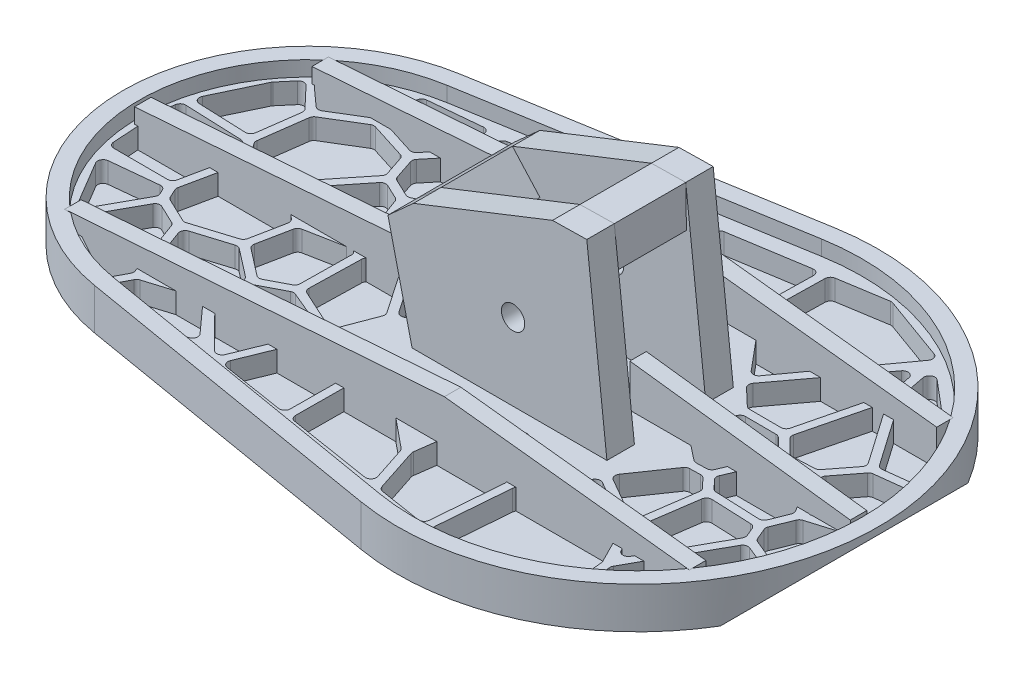
from build123d import *

# Parameters (mm, degrees)
BOSS_EXTRUDE1_DEPTH  = 0.8
BOSS_EXTRUDE2_DEPTH  = 6
BOSS_EXTRUDE3_DEPTH  = 3
BOSS_EXTRUDE4_DEPTH  = 2.4
BOSS_EXTRUDE5_DEPTH  = 2.4
BOSS_EXTRUDE6_DEPTH  = 2.4
BOSS_EXTRUDE7_DEPTH  = 2.4
CUT_EXTRUDE1_DEPTH   = 80
SKETCH9_R            = 1.7
BOSS_EXTRUDE8_DEPTH  = 4
SKETCH10_R           = 1.7
BOSS_EXTRUDE9_DEPTH  = 4
BOSS_EXTRUDE10_DEPTH = 10.4


with BuildPart() as part:
    # Sketch1 → Boss-Extrude1 (new body)
    with BuildSketch(Plane(origin=(0, 34.84807753, 0), x_dir=(1, 0, 0), z_dir=(0, 1, 0))):
        with BuildLine():
            Line((258.230600508, -326.377640976), (304.897267175, -318.489534599))
            ThreePointArc((304.897267175, -318.489534599), (345.730600508, -353), (304.897267175, -387.510465401))
            Line((304.897267175, -387.510465401), (258.230600508, -379.622359024))
            ThreePointArc((258.230600508, -379.622359024), (235.730600508, -353), (258.230600508, -326.377640976))
        make_face()
    extrude(amount=BOSS_EXTRUDE1_DEPTH)

    # Sketch2 → Boss-Extrude2 (add)
    with BuildSketch(Plane(origin=(0, 34.84807753, 0), x_dir=(1, 0, 0), z_dir=(0, 1, 0))):
        with BuildLine():
            Line((258.230600508, -326.377640976), (304.897267175, -318.489534599))
            ThreePointArc((304.897267175, -318.489534599), (345.730600508, -353), (304.897267175, -387.510465401))
            Line((304.897267175, -387.510465401), (258.230600508, -379.622359024))
            ThreePointArc((258.230600508, -379.622359024), (235.730600508, -353), (258.230600508, -326.377640976))
        make_face()
        with BuildLine():
            Line((258.630600508, -328.744072889), (305.297267175, -320.855966512))
            ThreePointArc((305.297267175, -320.855966512), (343.330600508, -353), (305.297267175, -385.144033488))
            Line((305.297267175, -385.144033488), (258.630600508, -377.255927111))
            ThreePointArc((258.630600508, -377.255927111), (238.130600508, -353), (258.630600508, -328.744072889))
        make_face(mode=Mode.SUBTRACT)
    extrude(amount=BOSS_EXTRUDE2_DEPTH)

    # Sketch3 → Boss-Extrude3 (add)
    with BuildSketch(Plane(origin=(0, 35.64807753, 0), x_dir=(1, 0, 0), z_dir=(0, 1, 0))):
        with BuildLine():
            Line((258.630600508, -328.744072889), (305.297267175, -320.855966512))
            ThreePointArc((305.297267175, -320.855966512), (343.330600508, -353), (305.297267175, -385.144033488))
            Line((305.297267175, -385.144033488), (258.630600508, -377.255927111))
            ThreePointArc((258.630600508, -377.255927111), (238.130600508, -353), (258.630600508, -328.744072889))
        make_face()
        with BuildLine():
            Line((326.922143782, -349.480574758), (324.399924628, -355.488488963))
            ThreePointArc((324.399924628, -355.488488963), (324.112742556, -355.839948352), (323.680573177, -355.978609348))
            Line((323.680573177, -355.978609348), (322.223942781, -356.011906879))
            ThreePointArc((322.223942781, -356.011906879), (321.952266803, -355.970925293), (321.710478302, -355.840442927))
            Line((321.710478302, -355.840442927), (318.460255265, -353.278956484))
            ThreePointArc((318.460255265, -353.278956484), (318.206555937, -352.932013483), (318.169017405, -352.503850367))
            Line((318.169017405, -352.503850367), (319.154026869, -347.226318828))
            ThreePointArc((319.154026869, -347.226318828), (319.430552758, -346.75664969), (319.943745587, -346.573104637))
            Line((319.943745587, -346.573104637), (324.410983475, -346.591526743))
            ThreePointArc((324.410983475, -346.591526743), (324.715620163, -346.65315987), (324.973776767, -346.826241706))
            Line((324.973776767, -346.826241706), (326.750602001, -348.605625846))
            ThreePointArc((326.750602001, -348.605625846), (326.969563529, -349.016987053), (326.922143782, -349.480574758))
        make_face(mode=Mode.SUBTRACT)
        with BuildLine():
            Line((267.325741383, -343.373584244), (264.831543119, -342.194372363))
            ThreePointArc((264.831543119, -342.194372363), (264.575183731, -342.002206677), (264.414783247, -341.72486308))
            Line((264.414783247, -341.72486308), (263.455298782, -338.855878051))
            ThreePointArc((263.455298782, -338.855878051), (263.427375807, -338.456436937), (263.596516704, -338.093498579))
            Line((263.596516704, -338.093498579), (266.902608122, -334.080024183))
            ThreePointArc((266.902608122, -334.080024183), (267.283492583, -333.824456086), (267.742152727, -333.820109145))
            Line((267.742152727, -333.820109145), (274.252342235, -335.701151103))
            ThreePointArc((274.252342235, -335.701151103), (274.613828472, -335.922477465), (274.811502608, -336.297420919))
            Line((274.811502608, -336.297420919), (275.414108484, -339.029837554))
            ThreePointArc((275.414108484, -339.029837554), (275.354272645, -339.547953749), (274.987817689, -339.919081066))
            Line((274.987817689, -339.919081066), (268.022613616, -343.36729378))
            ThreePointArc((268.022613616, -343.36729378), (267.674898464, -343.450309116), (267.325741383, -343.373584244))
        make_face(mode=Mode.SUBTRACT)
        with BuildLine():
            Line((267.291550562, -344.938622591), (269.870728463, -351.953665016))
            ThreePointArc((269.870728463, -351.953665016), (269.816430112, -352.623179583), (269.271058789, -353.015312449))
            Line((269.271058789, -353.015312449), (263.577467138, -354.111069342))
            ThreePointArc((263.577467138, -354.111069342), (263.211121497, -354.096009838), (262.88997081, -353.919096996))
            Line((262.88997081, -353.919096996), (259.240546095, -350.621968835))
            ThreePointArc((259.240546095, -350.621968835), (258.979414349, -350.092318626), (259.152786099, -349.527817634))
            Line((259.152786099, -349.527817634), (263.811793632, -343.719020437))
            ThreePointArc((263.811793632, -343.719020437), (264.25614266, -343.440008185), (264.777796891, -343.496317673))
            Line((264.777796891, -343.496317673), (266.882627822, -344.491443713))
            ThreePointArc((266.882627822, -344.491443713), (267.131066553, -344.674818053), (267.291550562, -344.938622591))
        make_face(mode=Mode.SUBTRACT)
        with BuildLine():
            Line((256.579637732, -335.260485338), (256.116451189, -330.760747304))
            ThreePointArc((256.116451189, -330.760747304), (256.293461004, -330.171775999), (256.836153229, -329.882458142))
            Line((256.836153229, -329.882458142), (264.366667088, -329.162921723))
            ThreePointArc((264.366667088, -329.162921723), (264.86345969, -329.278844929), (265.189184604, -329.671457155))
            Line((265.189184604, -329.671457155), (266.229663931, -332.369643692))
            ThreePointArc((266.229663931, -332.369643692), (266.272957126, -332.785332386), (266.100717363, -333.166127416))
            Line((266.100717363, -333.166127416), (262.778236424, -337.199498092))
            ThreePointArc((262.778236424, -337.199498092), (262.387851847, -337.457942872), (261.919689979, -337.453666389))
            Line((261.919689979, -337.453666389), (257.134364274, -335.941383628))
            ThreePointArc((257.134364274, -335.941383628), (256.755209327, -335.683863967), (256.579637732, -335.260485338))
        make_face(mode=Mode.SUBTRACT)
        with BuildLine():
            Line((247.963371066, -358.753552873), (240.153646116, -358.731400586))
            ThreePointArc((240.153646116, -358.731400586), (239.607386915, -358.513740994), (239.357482873, -357.981460257))
            Line((239.357482873, -357.981460257), (238.884326607, -350.434315104))
            ThreePointArc((238.884326607, -350.434315104), (238.883827064, -350.34293437), (238.893751946, -350.252092833))
            Line((238.893751946, -350.252092833), (239.149710425, -348.724064956))
            ThreePointArc((239.149710425, -348.724064956), (239.434098999, -348.235456945), (239.970492998, -348.056862075))
            Line((239.970492998, -348.056862075), (248.235724477, -348.385410945))
            ThreePointArc((248.235724477, -348.385410945), (248.583196555, -348.480385373), (248.853777976, -348.718172422))
            Line((248.853777976, -348.718172422), (250.094370518, -350.445906031))
            ThreePointArc((250.094370518, -350.445906031), (250.227322643, -350.747426165), (250.227458025, -351.076957105))
            Line((250.227458025, -351.076957105), (248.748556741, -358.117999941))
            ThreePointArc((248.748556741, -358.117999941), (248.468963644, -358.575380479), (247.963371066, -358.753552873))
        make_face(mode=Mode.SUBTRACT)
        with BuildLine():
            Line((287.726497691, -326.010564725), (292.336737999, -325.273414739))
            ThreePointArc((292.336737999, -325.273414739), (292.932094213, -325.415309012), (293.252924733, -325.936510301))
            Line((293.252924733, -325.936510301), (295.290906258, -338.624715705))
            ThreePointArc((295.290906258, -338.624715705), (295.257210138, -339.012721826), (295.044294464, -339.338836981))
            Line((295.044294464, -339.338836981), (292.279218547, -341.896799248))
            ThreePointArc((292.279218547, -341.896799248), (291.921577954, -342.087714979), (291.516268184, -342.078793032))
            Line((291.516268184, -342.078793032), (287.103907231, -340.818681109))
            ThreePointArc((287.103907231, -340.818681109), (286.675453507, -340.518386598), (286.524230894, -340.017506264))
            Line((286.524230894, -340.017506264), (287.053445931, -326.768600501))
            ThreePointArc((287.053445931, -326.768600501), (287.254584157, -326.26937338), (287.726497691, -326.010564725))
        make_face(mode=Mode.SUBTRACT)
        with BuildLine():
            Line((309.091322249, -383.405543562), (302.965762049, -382.426102945))
            ThreePointArc((302.965762049, -382.426102945), (302.572828928, -382.244730648), (302.331849574, -381.885257006))
            Line((302.331849574, -381.885257006), (300.260730513, -375.564948328))
            ThreePointArc((300.260730513, -375.564948328), (300.224309536, -375.389026721), (300.228062954, -375.209413772))
            Line((300.228062954, -375.209413772), (301.25672014, -367.54495535))
            ThreePointArc((301.25672014, -367.54495535), (301.390278945, -367.198290506), (301.666021122, -366.949331232))
            Line((301.666021122, -366.949331232), (305.747395379, -364.719293309))
            ThreePointArc((305.747395379, -364.719293309), (306.353471132, -364.652892371), (306.830318412, -365.032831281))
            Line((306.830318412, -365.032831281), (310.74187319, -372.073944445))
            ThreePointArc((310.74187319, -372.073944445), (310.824459973, -372.293326764), (310.8399126, -372.527229297))
            Line((310.8399126, -372.527229297), (310.01500564, -382.680361775))
            ThreePointArc((310.01500564, -382.680361775), (309.711650392, -383.244821085), (309.091322249, -383.405543562))
        make_face(mode=Mode.SUBTRACT)
        with BuildLine():
            Line((272.001381704, -362.182053079), (272.17964336, -354.692904717))
            ThreePointArc((272.17964336, -354.692904717), (272.358574586, -354.207407105), (272.797216068, -353.932965919))
            Line((272.797216068, -353.932965919), (275.808219393, -353.228698486))
            ThreePointArc((275.808219393, -353.228698486), (276.281238822, -353.262405945), (276.652070219, -353.557986136))
            Line((276.652070219, -353.557986136), (280.755590119, -359.595716529))
            ThreePointArc((280.755590119, -359.595716529), (280.888441561, -359.951770244), (280.842004112, -360.328953644))
            Line((280.842004112, -360.328953644), (279.066623366, -365.012791138))
            ThreePointArc((279.066623366, -365.012791138), (278.622273879, -365.469348291), (277.985307235, -365.456526621))
            Line((277.985307235, -365.456526621), (272.4679031, -362.92837453))
            ThreePointArc((272.4679031, -362.92837453), (272.122785328, -362.62513504), (272.001381704, -362.182053079))
        make_face(mode=Mode.SUBTRACT)
        with BuildLine():
            Line((342.487341721, -355.102866477), (341.19541067, -362.338645524))
            ThreePointArc((341.19541067, -362.338645524), (340.790363155, -362.900665833), (340.098483942, -362.935786664))
            Line((340.098483942, -362.935786664), (336.634538085, -361.483163762))
            ThreePointArc((336.634538085, -361.483163762), (336.378819091, -361.31167812), (336.20680518, -361.056314177))
            Line((336.20680518, -361.056314177), (335.530741305, -359.453461383))
            ThreePointArc((335.530741305, -359.453461383), (335.467880349, -359.148844224), (335.525944549, -358.843276453))
            Line((335.525944549, -358.843276453), (336.696027521, -355.942647283))
            ThreePointArc((336.696027521, -355.942647283), (336.898783429, -355.650900356), (337.207876093, -355.475720584))
            Line((337.207876093, -355.475720584), (341.469733904, -354.196046402))
            ThreePointArc((341.469733904, -354.196046402), (342.232034547, -354.364989581), (342.487341721, -355.102866477))
        make_face(mode=Mode.SUBTRACT)
        with BuildLine():
            Line((335.02229156, -362.126007499), (329.211228348, -372.566997636))
            ThreePointArc((329.211228348, -372.566997636), (328.497496331, -372.97781039), (327.799346793, -372.541040732))
            Line((327.799346793, -372.541040732), (326.012153386, -369.032293223))
            ThreePointArc((326.012153386, -369.032293223), (325.935677951, -368.799420403), (325.933298719, -368.554323317))
            Line((325.933298719, -368.554323317), (327.152592848, -360.151024608))
            ThreePointArc((327.152592848, -360.151024608), (327.433788482, -359.649964533), (327.978323223, -359.466623053))
            Line((327.978323223, -359.466623053), (333.842085849, -359.716212387))
            ThreePointArc((333.842085849, -359.716212387), (334.264451587, -359.858441348), (334.545179215, -360.204582783))
            Line((334.545179215, -360.204582783), (335.06037908, -361.426049529))
            ThreePointArc((335.06037908, -361.426049529), (335.122083023, -361.78042232), (335.02229156, -362.126007499))
        make_face(mode=Mode.SUBTRACT)
        with BuildLine():
            Line((284.272839332, -339.800379801), (277.257768228, -339.206276559))
            ThreePointArc((277.257768228, -339.206276559), (276.798306138, -339.01104413), (276.54405118, -338.581421586))
            Line((276.54405118, -338.581421586), (275.942467336, -335.853639185))
            ThreePointArc((275.942467336, -335.853639185), (275.941779389, -335.512205849), (276.083518715, -335.201582025))
            Line((276.083518715, -335.201582025), (282.130007867, -327.133446045))
            ThreePointArc((282.130007867, -327.133446045), (282.356745065, -326.928325898), (282.643872719, -326.823246207))
            Line((282.643872719, -326.823246207), (284.884879014, -326.464922639))
            ThreePointArc((284.884879014, -326.464922639), (285.547446823, -326.661231385), (285.809888783, -327.300494588))
            Line((285.809888783, -327.300494588), (285.139048284, -339.048839779))
            ThreePointArc((285.139048284, -339.048839779), (284.864622557, -339.607499521), (284.272839332, -339.800379801))
        make_face(mode=Mode.SUBTRACT)
        with BuildLine():
            Line((272.966167548, -376.901743141), (266.836317973, -370.705612032))
            ThreePointArc((266.836317973, -370.705612032), (266.637706107, -370.36925783), (266.622031728, -369.978956488))
            Line((266.622031728, -369.978956488), (267.420723534, -366.166132778))
            ThreePointArc((267.420723534, -366.166132778), (267.566499503, -365.84648083), (267.835169143, -365.620108072))
            Line((267.835169143, -365.620108072), (271.074905947, -363.938472688))
            ThreePointArc((271.074905947, -363.938472688), (271.410225666, -363.849208416), (271.751799051, -363.910323448))
            Line((271.751799051, -363.910323448), (277.582114393, -366.345564648))
            ThreePointArc((277.582114393, -366.345564648), (278.011991622, -366.775464852), (278.015542297, -367.383408937))
            Line((278.015542297, -367.383408937), (274.27664792, -376.63875794))
            ThreePointArc((274.27664792, -376.63875794), (273.692291234, -377.123469792), (272.966167548, -376.901743141))
        make_face(mode=Mode.SUBTRACT)
        with BuildLine():
            Line((282.577780597, -349.956474101), (286.736947334, -352.3565723))
            ThreePointArc((286.736947334, -352.3565723), (287.071832241, -352.732991827), (287.115303291, -353.234937869))
            Line((287.115303291, -353.234937869), (286.151902974, -357.27747437))
            ThreePointArc((286.151902974, -357.27747437), (285.966876827, -357.628799767), (285.63572056, -357.847888188))
            Line((285.63572056, -357.847888188), (282.478112167, -358.942475663))
            ThreePointArc((282.478112167, -358.942475663), (281.964369102, -358.945969468), (281.554438237, -358.636290876))
            Line((281.554438237, -358.636290876), (277.685930415, -352.944346444))
            ThreePointArc((277.685930415, -352.944346444), (277.548212208, -352.462872287), (277.723726043, -351.993853565))
            Line((277.723726043, -351.993853565), (278.658909901, -350.828891944))
            ThreePointArc((278.658909901, -350.828891944), (278.856064205, -350.652993904), (279.09976212, -350.550909299))
            Line((279.09976212, -350.550909299), (281.994928056, -349.870593179))
            ThreePointArc((281.994928056, -349.870593179), (282.294547847, -349.857926246), (282.577780597, -349.956474101))
        make_face(mode=Mode.SUBTRACT)
        with BuildLine():
            Line((325.762620909, -345.371386386), (328.036406295, -336.178568771))
            ThreePointArc((328.036406295, -336.178568771), (328.667449452, -335.58400775), (329.469454251, -335.913411114))
            Line((329.469454251, -335.913411114), (334.744027725, -343.485952154))
            ThreePointArc((334.744027725, -343.485952154), (334.887326422, -343.963206708), (334.720339199, -344.432697595))
            Line((334.720339199, -344.432697595), (332.137737838, -347.771141827))
            ThreePointArc((332.137737838, -347.771141827), (331.873309304, -347.991802426), (331.540616089, -348.080846089))
            Line((331.540616089, -348.080846089), (328.429113849, -348.219604106))
            ThreePointArc((328.429113849, -348.219604106), (328.103602052, -348.166035565), (327.827380801, -347.985676648))
            Line((327.827380801, -347.985676648), (325.973125543, -346.128750973))
            ThreePointArc((325.973125543, -346.128750973), (325.768436506, -345.777706479), (325.762620909, -345.371386386))
        make_face(mode=Mode.SUBTRACT)
        with BuildLine():
            Line((284.932669451, -379.542718768), (276.028514612, -378.118997405))
            ThreePointArc((276.028514612, -378.118997405), (275.458260339, -377.722474488), (275.413064141, -377.029381664))
            Line((275.413064141, -377.029381664), (279.248338556, -367.535451201))
            ThreePointArc((279.248338556, -367.535451201), (279.685362051, -367.095415711), (280.305523786, -367.099909081))
            Line((280.305523786, -367.099909081), (285.443344235, -369.304219045))
            ThreePointArc((285.443344235, -369.304219045), (285.797615947, -369.601795424), (285.927895228, -370.045740754))
            Line((285.927895228, -370.045740754), (285.858955203, -378.759082617))
            ThreePointArc((285.858955203, -378.759082617), (285.575678663, -379.363509087), (284.932669451, -379.542718768))
        make_face(mode=Mode.SUBTRACT)
        with BuildLine():
            Line((316.346704726, -321.536016207), (325.791712797, -324.959988504))
            ThreePointArc((325.791712797, -324.959988504), (326.283833297, -325.477305538), (326.166766495, -326.181645558))
            Line((326.166766495, -326.181645558), (315.879199558, -340.372400539))
            ThreePointArc((315.879199558, -340.372400539), (315.25918503, -340.702368993), (314.617827945, -340.416085417))
            Line((314.617827945, -340.416085417), (308.352644867, -332.924930079))
            ThreePointArc((308.352644867, -332.924930079), (308.211713652, -332.67736367), (308.166464051, -332.396110746))
            Line((308.166464051, -332.396110746), (308.34209313, -323.380942395))
            ThreePointArc((308.34209313, -323.380942395), (308.538318954, -322.87151037), (309.01563057, -322.606559086))
            Line((309.01563057, -322.606559086), (315.947743435, -321.498155498))
            ThreePointArc((315.947743435, -321.498155498), (316.149633231, -321.491699175), (316.346704726, -321.536016207))
        make_face(mode=Mode.SUBTRACT)
        with BuildLine():
            Line((250.894196868, -340.076180644), (255.845306796, -337.078138327))
            ThreePointArc((255.845306796, -337.078138327), (256.164554973, -336.968133571), (256.500750735, -336.999643173))
            Line((256.500750735, -336.999643173), (261.779742163, -338.667936666))
            ThreePointArc((261.779742163, -338.667936666), (262.099631007, -338.860376856), (262.297369551, -339.177017926))
            Line((262.297369551, -339.177017926), (263.223943492, -341.947596149))
            ThreePointArc((263.223943492, -341.947596149), (263.252801052, -342.34189818), (263.089314866, -342.701869176))
            Line((263.089314866, -342.701869176), (257.779244843, -349.322403624))
            ThreePointArc((257.779244843, -349.322403624), (257.522707957, -349.532442087), (257.203043521, -349.6204306))
            Line((257.203043521, -349.6204306), (251.676159988, -349.95171089))
            ThreePointArc((251.676159988, -349.95171089), (251.284580283, -349.875543505), (250.978465081, -349.619751365))
            Line((250.978465081, -349.619751365), (249.754645105, -347.915376374))
            ThreePointArc((249.754645105, -347.915376374), (249.628206607, -347.642182716), (249.611684513, -347.341602463))
            Line((249.611684513, -347.341602463), (250.515782749, -340.653333317))
            ThreePointArc((250.515782749, -340.653333317), (250.639552029, -340.32185225), (250.894196868, -340.076180644))
        make_face(mode=Mode.SUBTRACT)
        with BuildLine():
            Line((341.520194728, -344.691779549), (342.611836131, -351.882315639))
            ThreePointArc((342.611836131, -351.882315639), (342.49690528, -352.430196076), (342.050961565, -352.768598613))
            Line((342.050961565, -352.768598613), (337.224764374, -354.217722496))
            ThreePointArc((337.224764374, -354.217722496), (336.718858843, -354.202456582), (336.32336528, -353.886611215))
            Line((336.32336528, -353.886611215), (333.25873166, -349.157981369))
            ThreePointArc((333.25873166, -349.157981369), (333.130763558, -348.689539942), (333.297305768, -348.233385475))
            Line((333.297305768, -348.233385475), (335.939541422, -344.817853945))
            ThreePointArc((335.939541422, -344.817853945), (336.177926956, -344.611318862), (336.477616169, -344.512978743))
            Line((336.477616169, -344.512978743), (340.634569923, -344.017480147))
            ThreePointArc((340.634569923, -344.017480147), (341.213881949, -344.175351249), (341.520194728, -344.691779549))
        make_face(mode=Mode.SUBTRACT)
        with BuildLine():
            Line((269.150752043, -344.236633453), (274.38226386, -342.11946309))
            ThreePointArc((274.38226386, -342.11946309), (275.020524225, -342.13601644), (275.443399785, -342.614374639))
            Line((275.443399785, -342.614374639), (277.689213932, -349.543336114))
            ThreePointArc((277.689213932, -349.543336114), (277.715050307, -349.934397519), (277.552044467, -350.290804082))
            Line((277.552044467, -350.290804082), (276.442383628, -351.673112254))
            ThreePointArc((276.442383628, -351.673112254), (276.24488111, -351.849229739), (276.000729954, -351.951282794))
            Line((276.000729954, -351.951282794), (272.357815752, -352.80335287))
            ThreePointArc((272.357815752, -352.80335287), (271.801926313, -352.731736349), (271.42946079, -352.312914872))
            Line((271.42946079, -352.312914872), (268.704709868, -345.266745512))
            ThreePointArc((268.704709868, -345.266745512), (268.716731269, -344.66032587), (269.150752043, -344.236633453))
        make_face(mode=Mode.SUBTRACT)
        with BuildLine():
            Line((333.791000101, -358.512951377), (327.332296899, -358.238038571))
            ThreePointArc((327.332296899, -358.238038571), (327.034796633, -358.166837613), (326.785768907, -357.98918296))
            Line((326.785768907, -357.98918296), (325.665684826, -356.807789029))
            ThreePointArc((325.665684826, -356.807789029), (325.459251616, -356.401101013), (325.508599675, -355.947697681))
            Line((325.508599675, -355.947697681), (328.049213281, -349.895967978))
            ThreePointArc((328.049213281, -349.895967978), (328.32924535, -349.54943718), (328.75120666, -349.406432963))
            Line((328.75120666, -349.406432963), (331.441032351, -349.28647969))
            ThreePointArc((331.441032351, -349.28647969), (331.842967429, -349.374469208), (332.14800966, -349.650590919))
            Line((332.14800966, -349.650590919), (335.492032246, -354.81030884))
            ThreePointArc((335.492032246, -354.81030884), (335.617026846, -355.168874569), (335.562606745, -355.544682346))
            Line((335.562606745, -355.544682346), (334.566932143, -358.012954139))
            ThreePointArc((334.566932143, -358.012954139), (334.258352822, -358.386150808), (333.791000101, -358.512951377))
        make_face(mode=Mode.SUBTRACT)
        with BuildLine():
            Line((252.043978862, -351.131817636), (257.308278372, -350.816276579))
            ThreePointArc((257.308278372, -350.816276579), (257.620994077, -350.859956186), (257.892451559, -351.021231901))
            Line((257.892451559, -351.021231901), (262.013665158, -354.744604892))
            ThreePointArc((262.013665158, -354.744604892), (262.236799745, -355.086724595), (262.261963346, -355.494403058))
            Line((262.261963346, -355.494403058), (261.287383369, -360.390214088))
            ThreePointArc((261.287383369, -360.390214088), (261.097472859, -360.769132887), (260.740633844, -360.997849687))
            Line((260.740633844, -360.997849687), (254.818784235, -362.841926391))
            ThreePointArc((254.818784235, -362.841926391), (254.523417185, -362.87603417), (254.235994312, -362.799921574))
            Line((254.235994312, -362.799921574), (250.798466408, -361.157234558))
            ThreePointArc((250.798466408, -361.157234558), (250.574248805, -360.997614909), (250.417397378, -360.771452145))
            Line((250.417397378, -360.771452145), (249.841005451, -359.52615878))
            ThreePointArc((249.841005451, -359.52615878), (249.772131562, -359.280515459), (249.784092003, -359.025679823))
            Line((249.784092003, -359.025679823), (251.308928309, -351.765940535))
            ThreePointArc((251.308928309, -351.765940535), (251.569276311, -351.324643366), (252.043978862, -351.131817636))
        make_face(mode=Mode.SUBTRACT)
        with BuildLine():
            Line((327.539113392, -333.191350595), (324.672370188, -344.781471453))
            ThreePointArc((324.672370188, -344.781471453), (324.387591392, -345.220348567), (323.8924742, -345.389378298))
            Line((323.8924742, -345.389378298), (319.336807679, -345.370591527))
            ThreePointArc((319.336807679, -345.370591527), (319.041821415, -345.312909506), (318.788941901, -345.150440853))
            Line((318.788941901, -345.150440853), (316.404659149, -342.88407939))
            ThreePointArc((316.404659149, -342.88407939), (316.158731116, -342.372376423), (316.314239618, -341.826356617))
            Line((316.314239618, -341.826356617), (325.524630826, -329.460826158))
            ThreePointArc((325.524630826, -329.460826158), (326.343830463, -329.158672557), (326.951450086, -329.785715808))
            Line((326.951450086, -329.785715808), (327.547751354, -332.846273642))
            ThreePointArc((327.547751354, -332.846273642), (327.562265913, -333.019283559), (327.539113392, -333.191350595))
        make_face(mode=Mode.SUBTRACT)
        with BuildLine():
            Line((255.049196393, -375.60326701), (246.982607538, -371.085188441))
            ThreePointArc((246.982607538, -371.085188441), (246.905993222, -371.0358419), (246.836029199, -370.977447808))
            Line((246.836029199, -370.977447808), (246.393863388, -370.559582746))
            ThreePointArc((246.393863388, -370.559582746), (246.171091784, -370.136008677), (246.254303078, -369.66471465))
            Line((246.254303078, -369.66471465), (249.999616141, -362.877302633))
            ThreePointArc((249.999616141, -362.877302633), (250.421277489, -362.530365786), (250.966070197, -362.567303195))
            Line((250.966070197, -362.567303195), (253.722520628, -363.8845246))
            ThreePointArc((253.722520628, -363.8845246), (253.950437382, -364.053839395), (254.097770862, -364.296545786))
            Line((254.097770862, -364.296545786), (257.177213248, -372.669221762))
            ThreePointArc((257.177213248, -372.669221762), (257.221042506, -372.97363183), (257.137266154, -373.269550766))
            Line((257.137266154, -373.269550766), (256.064814938, -375.303009033))
            ThreePointArc((256.064814938, -375.303009033), (255.62030364, -375.667242564), (255.049196393, -375.60326701))
        make_face(mode=Mode.SUBTRACT)
        with BuildLine():
            Line((322.463076227, -357.206753946), (323.994739371, -357.17174122))
            ThreePointArc((323.994739371, -357.17174122), (324.320564291, -357.233008245), (324.593570976, -357.421111613))
            Line((324.593570976, -357.421111613), (325.837991158, -358.733647409))
            ThreePointArc((325.837991158, -358.733647409), (326.019956302, -359.042051029), (326.04915162, -359.398942806))
            Line((326.04915162, -359.398942806), (324.978834918, -366.775498424))
            ThreePointArc((324.978834918, -366.775498424), (324.535817559, -367.380633315), (323.786358388, -367.353000559))
            Line((323.786358388, -367.353000559), (318.299147328, -364.176849149))
            ThreePointArc((318.299147328, -364.176849149), (317.919362682, -363.659797554), (318.041544446, -363.029995724))
            Line((318.041544446, -363.029995724), (321.822988883, -357.552068446))
            ThreePointArc((321.822988883, -357.552068446), (322.101523089, -357.302467761), (322.463076227, -357.206753946))
        make_face(mode=Mode.SUBTRACT)
        with BuildLine():
            Line((327.751958928, -379.961725058), (316.35572279, -384.454261321))
            ThreePointArc((316.35572279, -384.454261321), (316.148939299, -384.505301552), (315.936016577, -384.499969447))
            Line((315.936016577, -384.499969447), (311.864522255, -383.848961738))
            ThreePointArc((311.864522255, -383.848961738), (311.361589964, -383.553013531), (311.193460446, -382.994212408))
            Line((311.193460446, -382.994212408), (312.039815634, -372.577090521))
            ThreePointArc((312.039815634, -372.577090521), (312.084003528, -372.372221185), (312.179883447, -372.185858485))
            Line((312.179883447, -372.185858485), (316.791067599, -365.53926121))
            ThreePointArc((316.791067599, -365.53926121), (317.273960428, -365.214520673), (317.849139502, -365.302900155))
            Line((317.849139502, -365.302900155), (324.616807891, -369.22021612))
            ThreePointArc((324.616807891, -369.22021612), (324.796682679, -369.362270368), (324.928895523, -369.549497804))
            Line((324.928895523, -369.549497804), (327.803596364, -375.193318654))
            ThreePointArc((327.803596364, -375.193318654), (327.858331861, -375.331013705), (327.886734332, -375.476441355))
            Line((327.886734332, -375.476441355), (328.254556221, -379.137495147))
            ThreePointArc((328.254556221, -379.137495147), (328.141593787, -379.633964486), (327.751958928, -379.961725058))
        make_face(mode=Mode.SUBTRACT)
        with BuildLine():
            Line((247.07522048, -335.086107981), (253.485306516, -331.087279861))
            ThreePointArc((253.485306516, -331.087279861), (254.235417557, -331.035774252), (254.696967256, -331.629315553))
            Line((254.696967256, -331.629315553), (255.347844411, -335.381855261))
            ThreePointArc((255.347844411, -335.381855261), (255.287687158, -335.850098503), (254.973988893, -336.202893102))
            Line((254.973988893, -336.202893102), (250.589232481, -338.85799175))
            ThreePointArc((250.589232481, -338.85799175), (250.099613972, -338.97012608), (249.639657734, -338.768282944))
            Line((249.639657734, -338.768282944), (246.963450955, -336.359472709))
            ThreePointArc((246.963450955, -336.359472709), (246.701714336, -335.694911144), (247.07522048, -335.086107981))
        make_face(mode=Mode.SUBTRACT)
        with BuildLine():
            Line((240.055927769, -345.743566016), (243.27560574, -338.979336717))
            ThreePointArc((243.27560574, -338.979336717), (243.325934309, -338.889120628), (243.387468668, -338.806142135))
            Line((243.387468668, -338.806142135), (245.03599774, -336.859608639))
            ThreePointArc((245.03599774, -336.859608639), (245.623951124, -336.576946936), (246.226886126, -336.826057761))
            Line((246.226886126, -336.826057761), (249.110073765, -339.865475853))
            ThreePointArc((249.110073765, -339.865475853), (249.290963959, -340.170225064), (249.322457779, -340.523214417))
            Line((249.322457779, -340.523214417), (248.518492927, -346.470724433))
            ThreePointArc((248.518492927, -346.470724433), (248.240068518, -346.976279935), (247.69392788, -347.162926445))
            Line((247.69392788, -347.162926445), (240.746498049, -346.886761134))
            ThreePointArc((240.746498049, -346.886761134), (240.093511906, -346.501036629), (240.055927769, -345.743566016))
        make_face(mode=Mode.SUBTRACT)
        with BuildLine():
            Line((295.101618148, -324.831326859), (306.20634843, -323.05574658))
            ThreePointArc((306.20634843, -323.05574658), (306.857673496, -323.242089732), (307.132507453, -323.861294389))
            Line((307.132507453, -323.861294389), (306.963852488, -332.518476417))
            ThreePointArc((306.963852488, -332.518476417), (306.932139804, -332.726428906), (306.84731783, -332.918926087))
            Line((306.84731783, -332.918926087), (302.692074799, -339.743724444))
            ThreePointArc((302.692074799, -339.743724444), (302.312565121, -340.067762244), (301.814843405, -340.103834185))
            Line((301.814843405, -340.103834185), (297.044081195, -338.911866465))
            ThreePointArc((297.044081195, -338.911866465), (296.648634132, -338.676695259), (296.448123072, -338.2625948))
            Line((296.448123072, -338.2625948), (294.438052997, -325.748162415))
            ThreePointArc((294.438052997, -325.748162415), (294.579857653, -325.152246995), (295.101618148, -324.831326859))
        make_face(mode=Mode.SUBTRACT)
        with BuildLine():
            Line((336.716282945, -334.366205058), (340.516703025, -341.735441664))
            ThreePointArc((340.516703025, -341.735441664), (340.51230069, -342.477217933), (339.900374059, -342.896499714))
            Line((339.900374059, -342.896499714), (336.587247543, -343.291416192))
            ThreePointArc((336.587247543, -343.291416192), (336.164979147, -343.22689633), (335.836108816, -342.954283569))
            Line((335.836108816, -342.954283569), (328.857039206, -332.934650454))
            ThreePointArc((328.857039206, -332.934650454), (328.776769698, -332.789244373), (328.728255287, -332.630397043))
            Line((328.728255287, -332.630397043), (327.976315754, -328.771014959))
            ThreePointArc((327.976315754, -328.771014959), (328.356390698, -327.928208881), (329.277594169, -328.00671502))
            Line((329.277594169, -328.00671502), (336.521309749, -334.121577135))
            ThreePointArc((336.521309749, -334.121577135), (336.630869866, -334.234268267), (336.716282945, -334.366205058))
        make_face(mode=Mode.SUBTRACT)
        with BuildLine():
            Line((269.172160284, -377.190782791), (258.12966414, -376.358927908))
            ThreePointArc((258.12966414, -376.358927908), (257.489673721, -375.948331386), (257.48214222, -375.187989018))
            Line((257.48214222, -375.187989018), (258.206015095, -373.815464783))
            ThreePointArc((258.206015095, -373.815464783), (258.403012824, -373.572816974), (258.677948711, -373.424168657))
            Line((258.677948711, -373.424168657), (265.20572474, -371.411742261))
            ThreePointArc((265.20572474, -371.411742261), (265.654600933, -371.405167612), (266.036343801, -371.641399374))
            Line((266.036343801, -371.641399374), (269.827191041, -375.858204888))
            ThreePointArc((269.827191041, -375.858204888), (269.950207245, -376.745953345), (269.172160284, -377.190782791))
        make_face(mode=Mode.SUBTRACT)
        with BuildLine():
            Line((258.051212914, -371.569180808), (255.544272995, -364.753078085))
            ThreePointArc((255.544272995, -364.753078085), (255.577631966, -364.123033393), (256.057243531, -363.713104275))
            Line((256.057243531, -363.713104275), (261.19523645, -362.11312223))
            ThreePointArc((261.19523645, -362.11312223), (261.575140041, -362.089656526), (261.922888172, -362.244409927))
            Line((261.922888172, -362.244409927), (265.909471488, -365.331374114))
            ThreePointArc((265.909471488, -365.331374114), (266.170429029, -365.687558588), (266.202681039, -366.127928916))
            Line((266.202681039, -366.127928916), (265.466155428, -369.643981406))
            ThreePointArc((265.466155428, -369.643981406), (265.274398319, -370.018872658), (264.918833813, -370.244456617))
            Line((264.918833813, -370.244456617), (259.037723108, -372.057524708))
            ThreePointArc((259.037723108, -372.057524708), (258.447126781, -372.00999311), (258.051212914, -371.569180808))
        make_face(mode=Mode.SUBTRACT)
        with BuildLine():
            Line((262.471017709, -360.590705204), (263.410187517, -355.872777465))
            ThreePointArc((263.410187517, -355.872777465), (263.630910881, -355.461481164), (264.04360389, -355.24338043))
            Line((264.04360389, -355.24338043), (269.950368401, -354.106597478))
            ThreePointArc((269.950368401, -354.106597478), (270.615452818, -354.279064971), (270.90147332, -354.903784581))
            Line((270.90147332, -354.903784581), (270.794805571, -362.257296377))
            ThreePointArc((270.794805571, -362.257296377), (270.675543049, -362.666063184), (270.36344947, -362.955737915))
            Line((270.36344947, -362.955737915), (267.487571613, -364.448506698))
            ThreePointArc((267.487571613, -364.448506698), (267.047063939, -364.535219947), (266.629216063, -364.37099647))
            Line((266.629216063, -364.37099647), (262.765827349, -361.379426582))
            ThreePointArc((262.765827349, -361.379426582), (262.506260098, -361.02699016), (262.471017709, -360.590705204))
        make_face(mode=Mode.SUBTRACT)
        with BuildLine():
            Line((340.130106278, -365.170208146), (334.283885634, -374.628314206))
            ThreePointArc((334.283885634, -374.628314206), (334.214784318, -374.723631492), (334.132442142, -374.807775076))
            Line((334.132442142, -374.807775076), (330.610356399, -377.912934855))
            ThreePointArc((330.610356399, -377.912934855), (329.7889964, -378.057533077), (329.285311939, -377.392820464))
            Line((329.285311939, -377.392820464), (329.098368954, -375.532114661))
            ThreePointArc((329.098368954, -375.532114661), (329.110928933, -375.290175682), (329.195334862, -375.0630901))
            Line((329.195334862, -375.0630901), (335.804509771, -363.18809795))
            ThreePointArc((335.804509771, -363.18809795), (336.235171733, -362.823505348), (336.799344154, -362.833848023))
            Line((336.799344154, -362.833848023), (339.745418616, -364.006280138))
            ThreePointArc((339.745418616, -364.006280138), (340.209199019, -364.49853215), (340.130106278, -365.170208146))
        make_face(mode=Mode.SUBTRACT)
        with BuildLine():
            Line((274.455777913, -334.510844261), (268.079740454, -332.668563945))
            ThreePointArc((268.079740454, -332.668563945), (267.692871896, -332.418845549), (267.507738395, -331.997238925))
            Line((267.507738395, -331.997238925), (267.282282176, -330.156076233))
            ThreePointArc((267.282282176, -330.156076233), (267.435393385, -329.580119324), (267.944205366, -329.269829503))
            Line((267.944205366, -329.269829503), (278.649915199, -327.476809525))
            ThreePointArc((278.649915199, -327.476809525), (279.465414157, -327.849853583), (279.42223636, -328.745585741))
            Line((279.42223636, -328.745585741), (275.318020204, -334.222048727))
            ThreePointArc((275.318020204, -334.222048727), (274.931920334, -334.500864249), (274.455777913, -334.510844261))
        make_face(mode=Mode.SUBTRACT)
        with BuildLine():
            Line((284.83868989, -342.213480998), (282.138699585, -348.279392194))
            ThreePointArc((282.138699585, -348.279392194), (281.917927914, -348.57035582), (281.590832876, -348.732863661))
            Line((281.590832876, -348.732863661), (279.610373408, -349.198238887))
            ThreePointArc((279.610373408, -349.198238887), (279.034539889, -349.116361262), (278.66634729, -348.666114221))
            Line((278.66634729, -348.666114221), (276.53754674, -342.098172247))
            ThreePointArc((276.53754674, -342.098172247), (276.652795845, -341.379307077), (277.302877137, -341.051520865))
            Line((277.302877137, -341.051520865), (284.112127461, -341.088176416))
            ThreePointArc((284.112127461, -341.088176416), (284.779906022, -341.454227417), (284.83868989, -342.213480998))
        make_face(mode=Mode.SUBTRACT)
        with BuildLine():
            Line((299.856337464, -381.92892446), (287.729219222, -379.989870432))
            ThreePointArc((287.729219222, -379.989870432), (287.244774136, -379.716603293), (287.055555052, -379.193575465))
            Line((287.055555052, -379.193575465), (287.128265489, -370.003690537))
            ThreePointArc((287.128265489, -370.003690537), (287.257426904, -369.574119514), (287.597489934, -369.28159418))
            Line((287.597489934, -369.28159418), (289.404117659, -368.461273042))
            ThreePointArc((289.404117659, -368.461273042), (289.838444724, -368.396432207), (290.24156218, -368.570617887))
            Line((290.24156218, -368.570617887), (298.894375263, -375.652613739))
            ThreePointArc((298.894375263, -375.652613739), (299.047596165, -375.81946428), (299.147904525, -376.022575039))
            Line((299.147904525, -376.022575039), (300.742871521, -380.889839281))
            ThreePointArc((300.742871521, -380.889839281), (300.591241517, -381.658202814), (299.856337464, -381.92892446))
        make_face(mode=Mode.SUBTRACT)
        with BuildLine():
            Line((244.363545664, -368.113066875), (240.687326432, -361.918525108))
            ThreePointArc((240.687326432, -361.918525108), (240.660842471, -361.150304929), (241.293960837, -360.714386613))
            Line((241.293960837, -360.714386613), (248.149854465, -360.013711576))
            ThreePointArc((248.149854465, -360.013711576), (248.627116799, -360.114409347), (248.957194142, -360.473530947))
            Line((248.957194142, -360.473530947), (249.242357263, -361.089625179))
            ThreePointArc((249.242357263, -361.089625179), (249.315853969, -361.453947429), (249.216793064, -361.812164408))
            Line((249.216793064, -361.812164408), (245.751955547, -368.091286981))
            ThreePointArc((245.751955547, -368.091286981), (245.064064715, -368.504684444), (244.363545664, -368.113066875))
        make_face(mode=Mode.SUBTRACT)
    extrude(amount=BOSS_EXTRUDE3_DEPTH)

    # Sketch4 → Boss-Extrude4 (add)
    with BuildSketch(Plane.XY.offset(333.8)):
        Polygon((246.464150179, 35.64807753), (246.464150179, 40.84807753), (301.736481777, 44.84807753), (337.410639158, 40.84807753), (337.410639158, 35.64807753), align=None)
    extrude(amount=BOSS_EXTRUDE4_DEPTH)

    # Sketch5 → Boss-Extrude5 (add)
    with BuildSketch(Plane.XY.offset(351.8)):
        Polygon((238.631538973, 35.64807753), (238.631538973, 40.84807753), (292.736481777, 44.84807753), (292.736481777, 35.64807753), align=None)
    extrude(amount=BOSS_EXTRUDE5_DEPTH)

    # Sketch6 → Boss-Extrude6 (add)
    with BuildSketch(Plane.XY.offset(351.8)):
        Polygon((310.736481777, 35.64807753), (310.736481777, 44.84807753), (342.829789901, 40.84807753), (342.829789901, 35.64807753), align=None)
    extrude(amount=BOSS_EXTRUDE6_DEPTH)

    # Sketch7 → Boss-Extrude7 (add)
    with BuildSketch(Plane.XY.offset(369.8)):
        Polygon((246.464150179, 35.64807753), (246.464150179, 40.84807753), (301.736481777, 44.84807753), (337.410639158, 40.84807753), (337.410639158, 35.64807753), align=None)
    extrude(amount=BOSS_EXTRUDE7_DEPTH)

    # Sketch8 → Cut-Extrude1 (cut)
    with BuildSketch(Plane.XY.offset(313)):
        Polygon((340.730600508, 34.84807753), (340.730600508, 33.84807753), (346.730600508, 33.84807753), (346.730600508, 40.84807753), align=None)
    extrude(amount=CUT_EXTRUDE1_DEPTH, mode=Mode.SUBTRACT)

    # Sketch9 → Boss-Extrude8 (add)
    with BuildSketch(Plane.XY.offset(343.8)):
        Polygon((283.524881777, 53.63477753), (287.736481777, 35.64807753), (315.736481777, 35.64807753), (312.472981777, 65.03777753), (307.473781777, 64.95047753), (287.240681777, 56.98047753), align=None)
        with Locations((301.736481777, 49.84807753)):
            Circle(SKETCH9_R, mode=Mode.SUBTRACT)
    extrude(amount=BOSS_EXTRUDE8_DEPTH)

    # Sketch10 → Boss-Extrude9 (add)
    with BuildSketch(Plane.XY.offset(358.2)):
        Polygon((283.524881777, 53.63477753), (287.736481777, 35.64807753), (315.736481777, 35.64807753), (312.472981777, 65.03777753), (307.473781777, 64.95047753), (287.240681777, 56.98047753), align=None)
        with Locations((301.736481777, 49.84807753)):
            Circle(SKETCH10_R, mode=Mode.SUBTRACT)
    extrude(amount=BOSS_EXTRUDE9_DEPTH)

    # Sketch11 → Boss-Extrude10 (add)
    with BuildSketch(Plane.XY.offset(347.8)):
        Polygon((307.57849629, 58.951421225), (312.577734765, 59.038683257), (312.473020327, 65.037769428), (307.473781851, 64.950507396), align=None)
        Polygon((291.255437367, 52.521597321), (287.539713239, 49.175944289), (283.524929601, 53.634813242), (287.240653728, 56.980466274), align=None)
    extrude(amount=BOSS_EXTRUDE10_DEPTH)


solid = part.part
